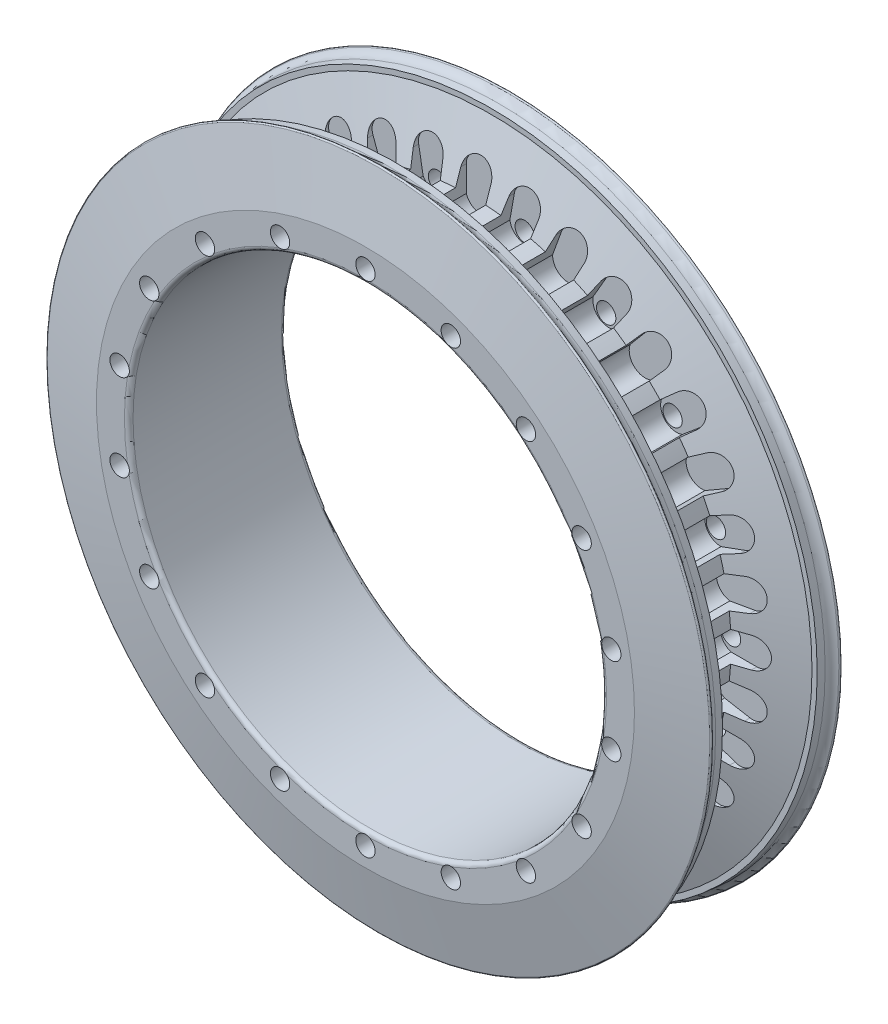
from build123d import *

# Parameters (mm, degrees)
CORTAR_EXTRUIR1_START = -6.18
CROQUIS3_R            = 2.25
CORTAR_EXTRUIR1_DEPTH = 293.591987551
CORTAR_EXTRUIR2_START = 6.18
CROQUIS4_R            = 2.25
CORTAR_EXTRUIR2_DEPTH = 293.591987557
CORTAR_EXTRUIR4_DEPTH = 8.68
MATRIZC1_COUNT        = 36


with BuildPart() as part:
    # Croquis2 → Revolución2 (revolve)
    with BuildSketch(Plane(origin=(0, 0, 0), x_dir=(0, 0, -1), z_dir=(1, 0, 0))):
        with BuildLine():
            Line((-17.25, 253), (17.25, 253))
            ThreePointArc((17.25, 253), (17.957106781, 253.292893219), (18.25, 254))
            Line((18.25, 254), (18.25, 260.5))
            Line((18.25, 260.5), (15.227019128, 274.966873141))
            ThreePointArc((15.227019128, 274.966873141), (14.982692165, 275.201427222), (14.675490119, 275.058815213))
            ThreePointArc((14.675490119, 275.058815213), (13.845196603, 274.212393697), (12.718301276, 273.843715483))
            Line((12.718301276, 273.843715483), (11, 273.711538462))
            Line((11, 273.711538462), (11, 272.5))
            Line((11, 272.5), (6.179413414, 258.5))
            Line((6.179413414, 258.5), (-6.179413414, 258.5))
            Line((-6.179413414, 258.5), (-11, 272.5))
            Line((-11, 272.5), (-11, 273.711538462))
            Line((-11, 273.711538462), (-12.718301276, 273.843715483))
            ThreePointArc((-12.718301276, 273.843715483), (-13.845196603, 274.212393697), (-14.675490119, 275.058815213))
            ThreePointArc((-14.675490119, 275.058815213), (-14.982692165, 275.201427222), (-15.227019128, 274.966873141))
            Line((-15.227019128, 274.966873141), (-18.25, 260.5))
            Line((-18.25, 260.5), (-18.25, 254))
            ThreePointArc((-18.25, 254), (-17.957106781, 253.292893219), (-17.25, 253))
        make_face()
    revolve(axis=Axis((0, 198, 23.25), (0, 0, -1)))

    # Croquis3 → Cortar-Extruir1 (cut, through all)
    with BuildSketch(Plane.XY.offset(CORTAR_EXTRUIR1_START)):
        with Locations((0, 256)):
            Circle(CROQUIS3_R)
        with Locations((19.837168313, 252.502172006)):
            Circle(CROQUIS3_R)
        with Locations((37.281681362, 242.430577701)):
            Circle(CROQUIS3_R)
        with Locations((50.229473419, 227)):
            Circle(CROQUIS3_R)
        with Locations((57.118849675, 208.071594305)):
            Circle(CROQUIS3_R)
        with Locations((57.118849675, 187.928405695)):
            Circle(CROQUIS3_R)
        with Locations((50.229473419, 169)):
            Circle(CROQUIS3_R)
        with Locations((37.281681362, 153.569422299)):
            Circle(CROQUIS3_R)
        with Locations((19.837168313, 143.497827994)):
            Circle(CROQUIS3_R)
        with Locations((0, 140)):
            Circle(CROQUIS3_R)
        with Locations((-19.837168313, 143.497827994)):
            Circle(CROQUIS3_R)
        with Locations((-37.281681362, 153.569422299)):
            Circle(CROQUIS3_R)
        with Locations((-50.229473419, 169)):
            Circle(CROQUIS3_R)
        with Locations((-57.118849675, 187.928405695)):
            Circle(CROQUIS3_R)
        with Locations((-57.118849675, 208.071594305)):
            Circle(CROQUIS3_R)
        with Locations((-50.229473419, 227)):
            Circle(CROQUIS3_R)
        with Locations((-37.281681362, 242.430577701)):
            Circle(CROQUIS3_R)
        with Locations((-19.837168313, 252.502172006)):
            Circle(CROQUIS3_R)
    extrude(amount=CORTAR_EXTRUIR1_DEPTH, mode=Mode.SUBTRACT)

    # Croquis4 → Cortar-Extruir2 (cut, through all)
    with BuildSketch(Plane.XY.offset(CORTAR_EXTRUIR2_START)):
        with Locations((10.071594305, 255.118849675)):
            Circle(CROQUIS4_R)
        with Locations((29, 248.229473419)):
            Circle(CROQUIS4_R)
        with Locations((44.430577701, 235.281681362)):
            Circle(CROQUIS4_R)
        with Locations((54.502172006, 217.837168313)):
            Circle(CROQUIS4_R)
        with Locations((58, 198)):
            Circle(CROQUIS4_R)
        with Locations((54.502172006, 178.162831687)):
            Circle(CROQUIS4_R)
        with Locations((44.430577701, 160.718318638)):
            Circle(CROQUIS4_R)
        with Locations((29, 147.770526581)):
            Circle(CROQUIS4_R)
        with Locations((10.071594305, 140.881150325)):
            Circle(CROQUIS4_R)
        with Locations((-10.071594305, 140.881150325)):
            Circle(CROQUIS4_R)
        with Locations((-29, 147.770526581)):
            Circle(CROQUIS4_R)
        with Locations((-44.430577701, 160.718318638)):
            Circle(CROQUIS4_R)
        with Locations((-54.502172006, 178.162831687)):
            Circle(CROQUIS4_R)
        with Locations((-58, 198)):
            Circle(CROQUIS4_R)
        with Locations((-54.502172006, 217.837168313)):
            Circle(CROQUIS4_R)
        with Locations((-44.430577701, 235.281681362)):
            Circle(CROQUIS4_R)
        with Locations((-29, 248.229473419)):
            Circle(CROQUIS4_R)
        with Locations((-10.071594305, 255.118849675)):
            Circle(CROQUIS4_R)
    extrude(amount=-CORTAR_EXTRUIR2_DEPTH, mode=Mode.SUBTRACT)

    # Croquis5 → Cortar-Extruir4 (cut, symmetric)
    with BuildSketch(Plane.XY):
        with BuildLine():
            Line((-3.5, 262), (-3.5, 256))
            ThreePointArc((-3.5, 256), (0, 253.5), (3.5, 256))
            Line((3.5, 256), (3.5, 262))
            ThreePointArc((3.5, 262), (0, 265.5), (-3.5, 262))
        make_face()
    cortar_extruir4 = extrude(amount=CORTAR_EXTRUIR4_DEPTH, both=True, mode=Mode.SUBTRACT)

    # MatrizC1: Cortar-Extruir4 ×36 about axis
    matrizc1_axis = Axis((0, 198, 18.25), (0, 0, 1))
    for i in range(1, MATRIZC1_COUNT):
        add(cortar_extruir4.rotate(matrizc1_axis, i * 360 / MATRIZC1_COUNT), mode=Mode.SUBTRACT)


solid = part.part
